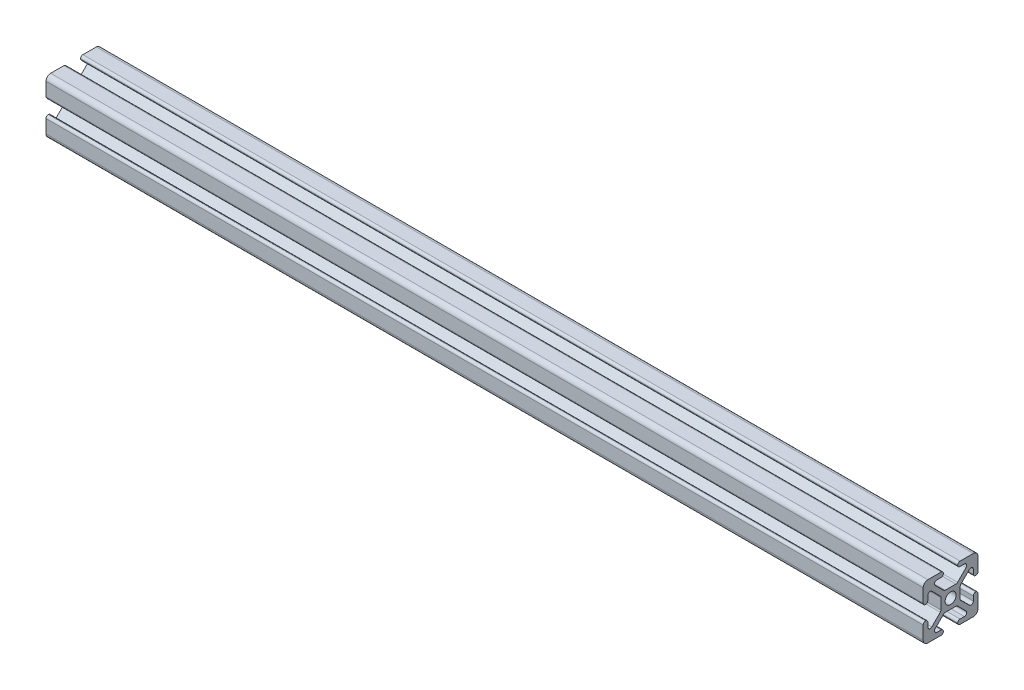
from build123d import *

# Parameters (mm, degrees)
SKETCH1_R           = 2.5
BOSS_EXTRUDE1_DEPTH = 400
FILLET1_R           = 1.065
FILLET2_R           = 2.13


with BuildPart() as part:
    # Sketch1 → Boss-Extrude1 (new body)
    with BuildSketch(Plane.YZ):
        Polygon((-12.5, -3.25), (-12.5, -12.5), (-3.25, -12.5), (-3.25, -10.37), (-8.863862556, -10.37), (-2.873862556, -4.38), (2.873862556, -4.38), (8.863862556, -10.37), (3.25, -10.37), (3.25, -12.5), (12.5, -12.5), (12.5, -3.25), (10.37, -3.25), (10.37, -8.863862556), (4.38, -2.873862556), (4.38, 2.873862556), (10.37, 8.863862556), (10.37, 3.25), (12.5, 3.25), (12.5, 12.5), (3.25, 12.5), (3.25, 10.37), (8.863862556, 10.37), (2.873862556, 4.38), (-2.873862556, 4.38), (-8.863862556, 10.37), (-3.25, 10.37), (-3.25, 12.5), (-12.5, 12.5), (-12.5, 3.25), (-10.37, 3.25), (-10.37, 8.863862556), (-4.38, 2.873862556), (-4.38, -2.873862556), (-10.37, -8.863862556), (-10.37, -3.25), align=None)
        with Locations(Location((0, 0, 0), (0, 0, 270))):
            Circle(SKETCH1_R, mode=Mode.SUBTRACT)
    extrude(amount=BOSS_EXTRUDE1_DEPTH)

    # Fillet1
    fillet1_edges = [part.edges().sort_by_distance(p)[0] for p in [
        (200, -10.37, -8.863862556),
        (200, 2.873862556, -4.38),
        (200, -2.873862556, -4.38),
        (200, -4.38, 2.873862556),
        (200, -4.38, -2.873862556),
        (200, -2.873862556, 4.38),
        (200, 2.873862556, 4.38),
        (200, 4.38, 2.873862556),
        (200, 4.38, -2.873862556),
        (200, -8.863862556, -10.37),
        (200, 8.863862556, -10.37),
        (200, 10.37, -8.863862556),
        (200, -10.37, 8.863862556),
        (200, -8.863862556, 10.37),
        (200, 10.37, 8.863862556),
        (200, 8.863862556, 10.37),
        (200, 12.5, 3.25),
        (200, -3.25, -12.5),
        (200, -10.37, 3.25),
        (200, 10.37, 3.25),
        (200, -10.37, -3.25),
        (200, -12.5, -3.25),
        (200, -12.5, 3.25),
        (200, 3.25, -10.37),
        (200, -3.25, -10.37),
        (200, 3.25, -12.5),
        (200, 10.37, -3.25),
        (200, 12.5, -3.25),
        (200, 3.25, 12.5),
        (200, 3.25, 10.37),
        (200, -3.25, 10.37),
        (200, -3.25, 12.5),
    ]]
    fillet(fillet1_edges, radius=FILLET1_R - 0.0001)  # a hair under: the kernel refuses the full size

    # Fillet2
    fillet2_edges = [part.edges().sort_by_distance(p)[0] for p in [
        (200, -12.5, 12.5),
        (200, 12.5, 12.5),
        (200, 12.5, -12.5),
        (200, -12.5, -12.5),
    ]]
    fillet(fillet2_edges, radius=FILLET2_R)


solid = part.part
